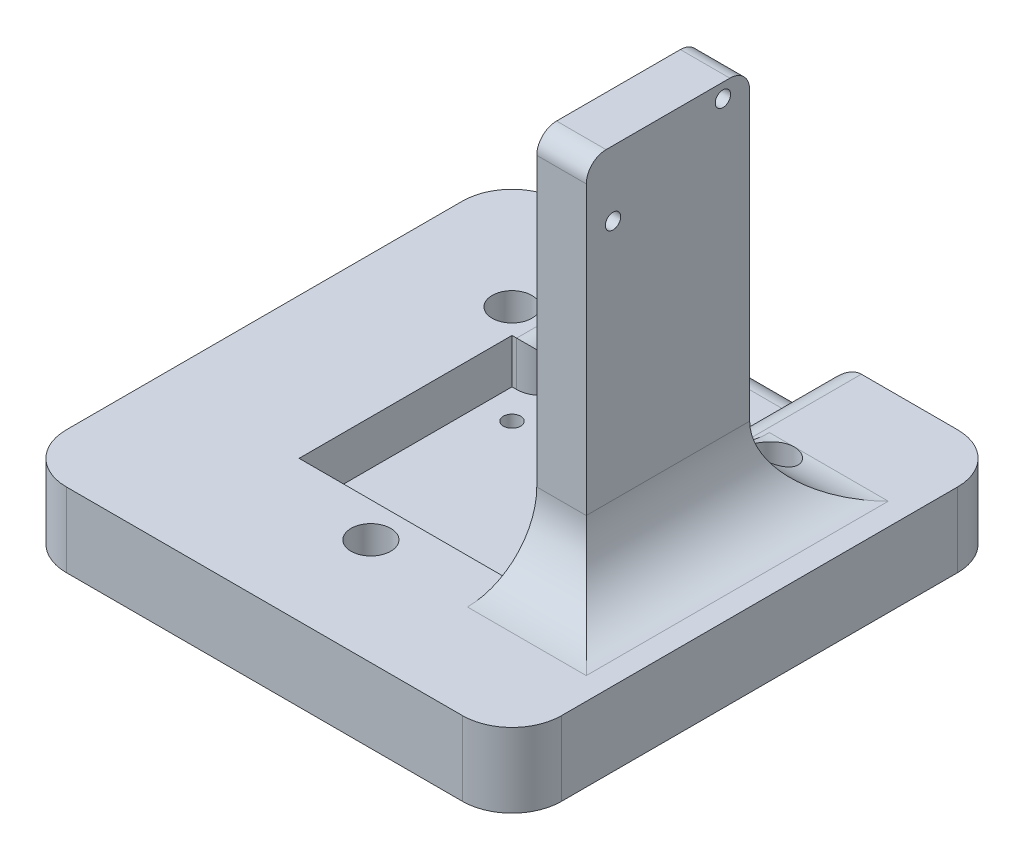
from build123d import *

# Parameters (mm, degrees)
SKETCH1_W               = 100
SKETCH1_H               = 100
BOSS_EXTRUDE1_DEPTH     = 15
SKETCH2_R               = 4.01
SKETCH2_W               = 43
SKETCH2_H               = 43
CUT_EXTRUDE1_DEPTH      = 9
SKETCH3_W               = 31.126627524
SKETCH3_H               = 9
CUT_EXTRUDE2_DEPTH      = 28.5
SKETCH4_R               = 1.75
CUT_EXTRUDE3_DEPTH      = 6
SKETCH5_R               = 3.75
CUT_EXTRUDE4_DEPTH      = 3
FILLET1_R               = 10
FILLET2_R               = 5
SKETCH6_W               = 10
SKETCH6_H               = 33
BOSS_EXTRUDE2_DEPTH     = 76
CUT_EXTRUDE5_DEPTH      = 132.99715906
CUT_EXTRUDE5_DEPTH_BACK = 132.99715906
SKETCH7_R               = 1.55
FILLET3_R               = 4
FILLET4_START           = 21.5
FILLET4_DEPTH           = 24
FILLET4_START_2         = -16.5
FILLET4_2_DEPTH         = 33
FILLET4_START_3         = -30.5
FILLET4_3_DEPTH         = 80.5
FILLET4_START_4         = 15
FILLET4_4_OUTLINE_R     = 4.01
FILLET4_4_DEPTH         = 14


with BuildPart() as part:
    # Sketch1 → Boss-Extrude1 (new body)
    with BuildSketch(Plane(origin=(0, 0, 0), x_dir=(1, 0, 0), z_dir=(0, 1, 0))):
        Rectangle(SKETCH1_W, SKETCH1_H)
    extrude(amount=BOSS_EXTRUDE1_DEPTH)

    # Sketch2 → Cut-Extrude1 (cut)
    with BuildSketch(Plane(origin=(0, 15, 0), x_dir=(1, 0, 0), z_dir=(0, 1, 0))):
        with Locations(Location((-26.5, 26.5, 0), (0, 0, 270))):
            Circle(SKETCH2_R)
        with Locations(Location((0, -28.5, 0), (0, 0, 270))):
            Circle(SKETCH2_R)
        with Locations(Location((26.5, 26.5, 0), (0, 0, 270))):
            Circle(SKETCH2_R)
        Rectangle(SKETCH2_W, SKETCH2_H)
    extrude(amount=-CUT_EXTRUDE1_DEPTH, mode=Mode.SUBTRACT)

    # Sketch3 → Cut-Extrude2 (cut)
    with BuildSketch(Plane(origin=(0, 0, -50), x_dir=(-1, 0, 0), z_dir=(0, 0, -1))):
        with Locations((0, 10.5)):
            Rectangle(SKETCH3_W, SKETCH3_H)
    extrude(amount=-CUT_EXTRUDE2_DEPTH, mode=Mode.SUBTRACT)

    # Sketch4 → Cut-Extrude3 (cut)
    with BuildSketch(Plane.XZ):
        with Locations(Location((-15.5, 15.5, 0), (0, 0, 270))):
            Circle(SKETCH4_R)
        with Locations(Location((15.5, 15.5, 0), (0, 0, 270))):
            Circle(SKETCH4_R)
        with Locations(Location((15.5, -15.5, 0), (0, 0, 270))):
            Circle(SKETCH4_R)
        with Locations(Location((-15.5, -15.5, 0), (0, 0, 270))):
            Circle(SKETCH4_R)
    extrude(amount=-CUT_EXTRUDE3_DEPTH, mode=Mode.SUBTRACT)

    # Sketch5 → Cut-Extrude4 (cut)
    with BuildSketch(Plane.XZ):
        with Locations(Location((-15.5, 15.5, 0), (0, 0, 270))):
            Circle(SKETCH5_R)
        with Locations(Location((15.5, 15.5, 0), (0, 0, 270))):
            Circle(SKETCH5_R)
        with Locations(Location((-15.5, -15.5, 0), (0, 0, 270))):
            Circle(SKETCH5_R)
        with Locations(Location((15.5, -15.5, 0), (0, 0, 270))):
            Circle(SKETCH5_R)
    extrude(amount=-CUT_EXTRUDE4_DEPTH, mode=Mode.SUBTRACT)

    # Fillet1
    fillet1_edges = [part.edges().sort_by_distance(p)[0] for p in [
        (50, 7.5, 50),
        (-50, 7.5, 50),
        (-50, 7.5, -50),
        (50, 7.5, -50),
    ]]
    fillet(fillet1_edges, radius=FILLET1_R)

    # Fillet2
    fillet2_edges = [part.edges().sort_by_distance(p)[0] for p in [
        (15.563313762, 15, -35.75),
        (-15.563313762, 15, -35.75),
        (15.563313762, 10.5, -50),
        (0, 6, -50),
        (-15.563313762, 10.5, -50),
        (15.563313762, 10.5, -21.5),
        (-15.563313762, 10.5, -21.5),
    ]]
    fillet(fillet2_edges, radius=FILLET2_R)

    # Sketch6 → Boss-Extrude2 (add)
    with BuildSketch(Plane(origin=(0, 15, 0), x_dir=(1, 0, 0), z_dir=(0, 1, 0))):
        with Locations((26.5, 0)):
            Rectangle(SKETCH6_W, SKETCH6_H)
    extrude(amount=BOSS_EXTRUDE2_DEPTH)

    # Sketch7 → Cut-Extrude5 (cut, two sides: drawn at the far end of the back side and taken through both)
    with BuildSketch(Plane(origin=(31.5, 0, 0), x_dir=(0, 0, -1), z_dir=(1, 0, 0)).offset(-CUT_EXTRUDE5_DEPTH_BACK)):
        with Locations((11.1, 88.1)):
            Circle(SKETCH7_R)
        with Locations((-11.1, 77.8)):
            Circle(SKETCH7_R)
    extrude(amount=CUT_EXTRUDE5_DEPTH + CUT_EXTRUDE5_DEPTH_BACK, mode=Mode.SUBTRACT)

    # Fillet3
    fillet3_edges = [part.edges().sort_by_distance(p)[0] for p in [
        (26.5, 91, 16.5),
        (26.5, 91, -16.5),
    ]]
    fillet(fillet3_edges, radius=FILLET3_R)

    # Fillet4: read off the stored shape, not the designer's step
    # Fillet4 outline → Fillet4 (add)
    with BuildSketch(Plane.YZ.offset(FILLET4_START)):
        with BuildLine():
            Line((15, 16.5), (29, 16.5))
            ThreePointArc((29, 16.5), (19.100505063, 20.600505063), (15, 30.5))
            Line((15, 30.5), (15, 16.5))
        make_face()
        with BuildLine():
            Line((29, -16.5), (15, -16.5))
            Line((15, -16.5), (15, -30.5))
            ThreePointArc((15, -30.5), (19.100505063, -20.600505063), (29, -16.5))
        make_face()
    extrude(amount=FILLET4_DEPTH)

    # Fillet4 2 outline → Fillet4 2 (add)
    with BuildSketch(Plane.XY.offset(FILLET4_START_2)):
        with BuildLine():
            ThreePointArc((45.5, 15), (35.600505063, 19.100505063), (31.5, 29))
            Line((31.5, 29), (31.5, 15))
            Line((31.5, 15), (45.5, 15))
        make_face()
    extrude(amount=FILLET4_2_DEPTH)

    # Fillet4 3 outline → Fillet4 3 (cut)
    with BuildSketch(Plane.XY.offset(FILLET4_START_3)):
        with BuildLine():
            Line((31.5, 30), (31.5, 29))
            ThreePointArc((31.5, 29), (35.600505063, 19.100505063), (45.5, 15))
            Line((45.5, 15), (47, 15))
            Line((47, 15), (47, 30))
            Line((47, 30), (31.5, 30))
        make_face()
    extrude(amount=FILLET4_3_DEPTH, mode=Mode.SUBTRACT)

    # Fillet4 4 outline → Fillet4 4 (cut)
    with BuildSketch(Plane(origin=(0, 0, 0), x_dir=(1, 0, 0), z_dir=(0, 1, 0)).offset(FILLET4_START_4)):
        with Locations((26.5, 26.5)):
            Circle(FILLET4_4_OUTLINE_R)
    extrude(amount=FILLET4_4_DEPTH, mode=Mode.SUBTRACT)


solid = part.part
